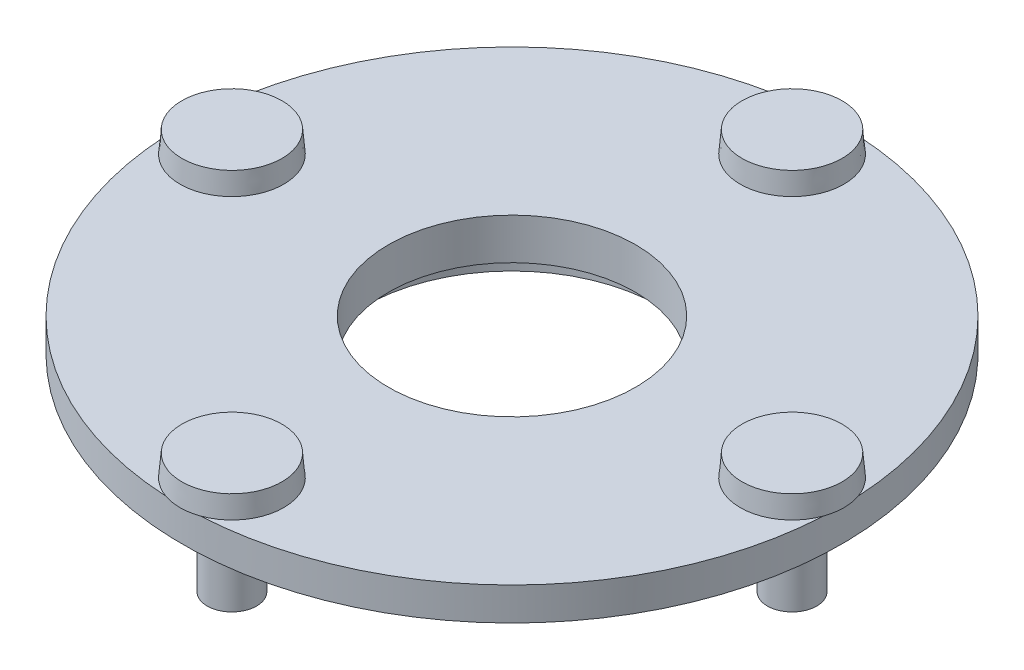
from build123d import *

# Parameters (mm, degrees)
SKETCH1_W           = 12.5
SKETCH1_H           = 4
SKETCH2_W           = 6
SKETCH2_H           = 2
SKETCH2_W_2         = 1.5
SKETCH2_H_2         = 1.5
SKETCH3_R           = 3.15
BOSS_EXTRUDE1_DEPTH = 1.3
SKETCH4_R           = 1.5
BOSS_EXTRUDE2_DEPTH = 4
CIRPATTERN1_COUNT   = 4
CHAMFER1_SIZE       = 1.3
CHAMFER1_SIZE_2     = 0.113735263


with BuildPart() as part:
    # Sketch1 → Revolve1 (revolve)
    with BuildSketch(Plane.XY, mode=Mode.PRIVATE) as revolve1_sk:
        with Locations((13.75, 2)):
            Rectangle(SKETCH1_W, SKETCH1_H)
    revolve(revolve1_sk.sketch.rotate(Axis((0, -5.176379432, 0), (0, 1, 0)), 90), axis=Axis((0, -5.176379432, 0), (0, 1, 0)))

    # Sketch2 → Cut-Revolve1 (revolve, cut)
    with BuildSketch(Plane.XY, mode=Mode.PRIVATE) as cut_revolve1_sk:
        with Locations((17, 1)):
            Rectangle(SKETCH2_W, SKETCH2_H)
        with Locations((8.25, 0.75)):
            Rectangle(SKETCH2_W_2, SKETCH2_H_2)
    revolve(cut_revolve1_sk.sketch.rotate(Axis((0, -1.233398275, 0), (0, 1, 0)), 90), axis=Axis((0, -1.233398275, 0), (0, 1, 0)), mode=Mode.SUBTRACT)

    # Sketch3 → Boss-Extrude1 (add)
    with BuildSketch(Plane(origin=(0, 4, 0), x_dir=(1, 0, 0), z_dir=(0, 1, 0))):
        with Locations(Location((17, 0, 0), (0, 0, 19.305796893))):
            Circle(SKETCH3_R)
    boss_extrude1 = extrude(amount=BOSS_EXTRUDE1_DEPTH)

    # Sketch4 → Boss-Extrude2 (add)
    with BuildSketch(Plane.XZ.offset(-2)):
        with Locations(Location((17, 0, 0), (0, 0, 90))):
            Circle(SKETCH4_R)
    boss_extrude2 = extrude(amount=BOSS_EXTRUDE2_DEPTH)

    # CirPattern1: Boss-Extrude1, Boss-Extrude2 ×4 about axis
    cirpattern1_axis = Axis((0, 0, 0), (0, 1, 0))
    add([boss_extrude1.rotate(cirpattern1_axis, i * 360 / CIRPATTERN1_COUNT) for i in range(1, CIRPATTERN1_COUNT)])
    add([boss_extrude2.rotate(cirpattern1_axis, i * 360 / CIRPATTERN1_COUNT) for i in range(1, CIRPATTERN1_COUNT)])

    # Chamfer1
    # the kernel refuses this chamfer: 1.3, 0.113735263 mm, written as the material it takes off along each edge
    with BuildSketch(Plane(origin=(17, 5.3, 0), x_dir=(0.9437675070022826, 0, -0.3306098799592901), z_dir=(0.3306098799592901, 0, 0.9437675070022826))) as chamfer1_piece_1_section:
        Polygon((3.15, -CHAMFER1_SIZE), (3.15 - CHAMFER1_SIZE_2 * 0.99999999634, 0), (3.15, 0), align=None)
    chamfer1_piece_1 = revolve(axis=Axis((17, 5.3, 0), (0, 1, 0)), mode=Mode.PRIVATE)
    chamfer1_piece_1 = split(chamfer1_piece_1, bisect_by=Plane(origin=(14.070685383, 4, 1.026164121), z_dir=(0, 1, 0)), keep=Keep.TOP, mode=Mode.PRIVATE)
    add(chamfer1_piece_1, mode=Mode.SUBTRACT)
    with BuildSketch(Plane(origin=(0, 5.3, 17), x_dir=(0.3306098799592899, 0, 0.9437675070022828), z_dir=(-0.9437675070022828, 0, 0.3306098799592899))) as chamfer1_piece_2_section:
        Polygon((3.15, -CHAMFER1_SIZE), (3.15 - CHAMFER1_SIZE_2 * 0.99999999634, 0), (3.15, 0), align=None)
    chamfer1_piece_2 = revolve(axis=Axis((0, 5.3, 17), (0, 1, 0)), mode=Mode.PRIVATE)
    chamfer1_piece_2 = split(chamfer1_piece_2, bisect_by=Plane(origin=(-1.026164121, 4, 14.070685383), z_dir=(0, 1, 0)), keep=Keep.TOP, mode=Mode.PRIVATE)
    add(chamfer1_piece_2, mode=Mode.SUBTRACT)
    with BuildSketch(Plane(origin=(-17, 5.3, 0), x_dir=(-0.9437675070022828, 0, 0.33060987995929), z_dir=(-0.33060987995929, 0, -0.9437675070022828))) as chamfer1_piece_3_section:
        Polygon((3.15, -CHAMFER1_SIZE), (3.15 - CHAMFER1_SIZE_2 * 0.99999999634, 0), (3.15, 0), align=None)
    chamfer1_piece_3 = revolve(axis=Axis((-17, 5.3, 0), (0, 1, 0)), mode=Mode.PRIVATE)
    chamfer1_piece_3 = split(chamfer1_piece_3, bisect_by=Plane(origin=(-14.070685383, 4, -1.026164121), z_dir=(0, 1, 0)), keep=Keep.TOP, mode=Mode.PRIVATE)
    add(chamfer1_piece_3, mode=Mode.SUBTRACT)
    with BuildSketch(Plane(origin=(0, 5.3, -17), x_dir=(-0.33060987995929003, 0, -0.9437675070022828), z_dir=(0.9437675070022828, 0, -0.33060987995929003))) as chamfer1_piece_4_section:
        Polygon((3.15, -CHAMFER1_SIZE), (3.15 - CHAMFER1_SIZE_2 * 0.99999999634, 0), (3.15, 0), align=None)
    chamfer1_piece_4 = revolve(axis=Axis((0, 5.3, -17), (0, 1, 0)), mode=Mode.PRIVATE)
    chamfer1_piece_4 = split(chamfer1_piece_4, bisect_by=Plane(origin=(1.026164121, 4, -14.070685383), z_dir=(0, 1, 0)), keep=Keep.TOP, mode=Mode.PRIVATE)
    add(chamfer1_piece_4, mode=Mode.SUBTRACT)


solid = part.part
